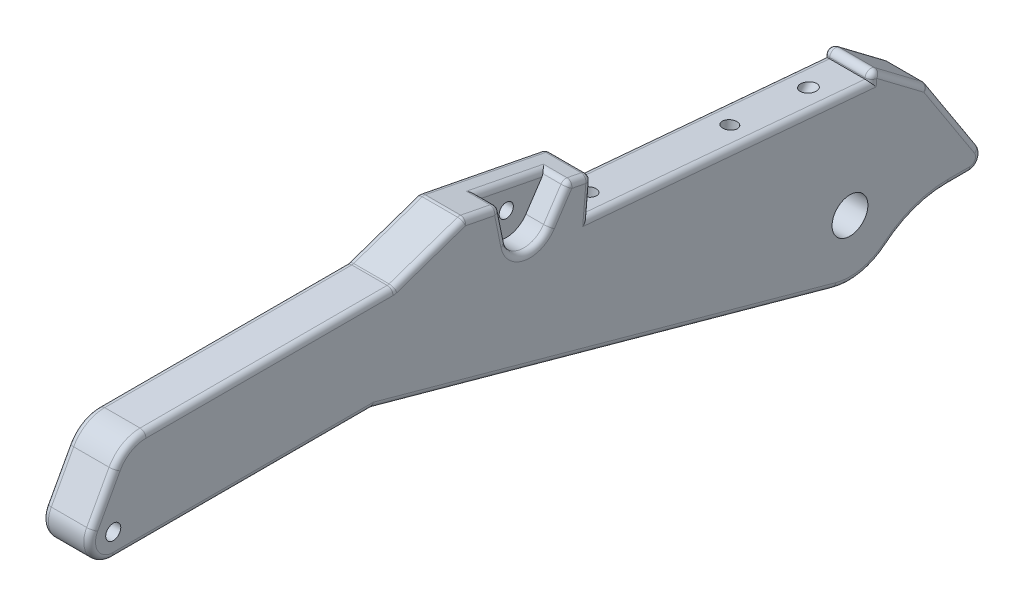
from build123d import *

# Parameters (mm, degrees)
SKETCH1_R           = 2.032
BOSS_EXTRUDE1_DEPTH = 12.7
FILLET1_R           = 9.525
SKETCH2_R           = 4.826
CUT_EXTRUDE1_DEPTH  = 238.90790865
CUT_EXTRUDE6_DEPTH  = 6.35
SKETCH10_R          = 1.905
CUT_EXTRUDE7_DEPTH  = 238.653540891
SKETCH4_R           = 5.715
CUT_EXTRUDE2_DEPTH  = 1.5875
FILLET2_R           = 1.5875
SKETCH6_R           = 1.905
CUT_EXTRUDE3_DEPTH  = 25.4
SKETCH7_R           = 1.905
CUT_EXTRUDE4_DEPTH  = 15.875
SKETCH8_R           = 1.905
CUT_EXTRUDE5_DEPTH  = 12.7


with BuildPart() as part:
    # Sketch1 → Boss-Extrude1 (new body)
    with BuildSketch(Plane(origin=(0, 0, 0), x_dir=(0, 0, -1), z_dir=(1, 0, 0))):
        with BuildLine():
            Line((-5.574599012, 3.040780467), (3.157961292, 19.05))
            Line((3.157961292, 19.05), (75.662744852, 19.05))
            Line((75.662744852, 19.05), (94.776183001, 25.614386431))
            Line((94.776183001, 25.614386431), (129.054233098, 18.923279907))
            Line((129.054233098, 18.923279907), (128.224074649, 9.434525408))
            Line((128.224074649, 9.434525408), (204.134110643, 2.79325781))
            Line((204.134110643, 2.79325781), (204.161005679, 3.100669472))
            ThreePointArc((204.161005679, 3.100669472), (205.09730431, 4.412800765), (206.698779384, 4.229439793))
            Line((206.698779384, 4.229439793), (219.392961654, -5.350975413))
            ThreePointArc((219.392961654, -5.350975413), (219.598467913, -5.536288257), (219.768672831, -5.75447157))
            Line((219.768672831, -5.75447157), (233.444725546, -26.84773219))
            ThreePointArc((233.444725546, -26.84773219), (233.570360338, -30.091006218), (230.780673949, -31.75))
            Line((230.780673949, -31.75), (224.896696771, -31.75))
            ThreePointArc((224.896696771, -31.75), (216.268745771, -33.260285445), (208.666831685, -37.611538462))
            ThreePointArc((208.666831685, -37.611538462), (201.862183679, -40.919877125), (194.299038193, -40.702691568))
            Line((194.299038193, -40.702691568), (69.85, -6.35))
            Line((69.85, -6.35), (0, -6.35))
            ThreePointArc((0, -6.35), (-5.460378007, -3.241415126), (-5.574599012, 3.040780467))
        make_face()
        Circle(SKETCH1_R, mode=Mode.SUBTRACT)
    extrude(amount=BOSS_EXTRUDE1_DEPTH)

    # Fillet1
    fillet1_edges = [part.edges().sort_by_distance(p)[0] for p in [
        (6.35, 19.05, -3.157961292),
    ]]
    fillet(fillet1_edges, radius=FILLET1_R)

    # Sketch2 → Cut-Extrude1 (cut, through all)
    with BuildSketch(Plane.ZY):
        with Locations((-198.523166007, -25.4)):
            Circle(SKETCH2_R)
    extrude(amount=-CUT_EXTRUDE1_DEPTH, mode=Mode.SUBTRACT)

    # Sketch9 → Cut-Extrude6 (cut)
    with BuildSketch(Plane(origin=(12.7, 0, 0), x_dir=(0, 0, -1), z_dir=(1, 0, 0))):
        with BuildLine():
            Line((106.035867409, 14.458235691), (104.124742118, 23.789539197))
            Line((104.124742118, 23.789539197), (122.821860353, 20.13984473))
            Line((122.821860353, 20.13984473), (117.541786323, 12.212269865))
            ThreePointArc((117.541786323, 12.212269865), (111.040171591, 9.499946473), (106.035867409, 14.458235691))
        make_face()
    extrude(amount=-CUT_EXTRUDE6_DEPTH, mode=Mode.SUBTRACT)

    # Sketch10 → Cut-Extrude7 (cut, through all)
    with BuildSketch(Plane(origin=(6.35, 0, 0), x_dir=(0, 0, -1), z_dir=(1, 0, 0))):
        with Locations((112.256736413, 15.732319218)):
            Circle(SKETCH10_R)
    extrude(amount=-CUT_EXTRUDE7_DEPTH, mode=Mode.SUBTRACT)

    # Sketch4 → Cut-Extrude2 (cut)
    with BuildSketch(Plane(origin=(0, 0, 0), x_dir=(0, 0, -1), z_dir=(1, 0, 0))):
        with Locations((198.523166007, -25.4)):
            Circle(SKETCH4_R)
    extrude(amount=CUT_EXTRUDE2_DEPTH, mode=Mode.SUBTRACT)

    # Fillet2
    fillet2_edges = [part.edges().sort_by_distance(p)[0] for p in [
        (0, 2.946963641, -204.147558161),
        (0, 4.412800765, -205.09730431),
        (0, -0.56076781, -213.045870519),
        (0, -5.536288257, -219.598467913),
        (0, -16.30110188, -226.606699189),
        (0, -30.091006218, -233.570360338),
        (0, -31.75, -227.83868536),
        (0, -33.260285445, -216.268745771),
        (0, -40.919877125, -201.862183679),
        (0, -6.35, -34.925),
        (0, -3.241415126, 5.460378007),
        (0, 8.563475584, 2.5621306),
        (0, 17.715567011, -3.950113643),
        (12.7, 2.946963641, -204.147558161),
        (12.7, 4.412800765, -205.09730431),
        (12.7, -0.56076781, -213.045870519),
        (12.7, -5.536288257, -219.598467913),
        (12.7, -16.30110188, -226.606699189),
        (12.7, -30.091006218, -233.570360338),
        (12.7, -31.75, -227.83868536),
        (12.7, -33.260285445, -216.268745771),
        (12.7, -40.919877125, -201.862183679),
        (12.7, -6.35, -34.925),
        (12.7, -3.241415126, 5.460378007),
        (12.7, 8.563475584, 2.5621306),
        (12.7, 17.715567011, -3.950113643),
        (0, -23.526345784, -132.074519097),
        (0, 6.113891609, -166.179092646),
        (0, 14.178902657, -128.639153874),
        (0, 19.05, -42.237490592),
        (12.7, -23.526345784, -132.074519097),
        (12.7, 6.113891609, -166.179092646),
        (12.7, 14.178902657, -128.639153874),
        (12.7, 19.05, -42.237490592),
        (12.7, 19.123887444, -105.080304764),
        (12.7, 16.176057297, -120.181823338),
        (12.7, 9.499946473, -111.040171591),
        (12.7, 19.531562318, -125.938046726),
        (0, 22.268833169, -111.91520805),
        (9.525, 20.13984473, -122.821860353),
        (9.525, 23.789539197, -104.124742118),
        (6.35, 21.964691963, -113.473301236),
        (12.7, 24.701962814, -99.45046256),
        (12.7, 22.332193215, -85.219463927),
        (0, 22.332193215, -85.219463927),
        (6.35, 25.614386431, -94.776183001),
        (6.35, 19.05, -75.662744852),
        (6.35, 18.923279907, -129.054233098),
    ]]
    fillet(fillet2_edges, radius=FILLET2_R)

    # Sketch6 → Cut-Extrude3 (cut)
    with BuildSketch(Plane(origin=(0, 102.082274381, -77.04242407), x_dir=(1, 0, 0), z_dir=(0, 0.798192165141452, -0.6024029112701905))):
        with Locations((6.35, 152.364748226)):
            Circle(SKETCH6_R)
    extrude(amount=-CUT_EXTRUDE3_DEPTH, mode=Mode.SUBTRACT)

    # Sketch7 → Cut-Extrude4 (cut)
    with BuildSketch(Plane(origin=(0, 20.495798036, -1.793149978), x_dir=(1, 0, 0), z_dir=(0, 0.996194698091746, -0.0871557427476538))):
        with Locations((6.35, 171.363870263)):
            Circle(SKETCH7_R)
        with Locations((6.35, 133.263870263)):
            Circle(SKETCH7_R)
    extrude(amount=-CUT_EXTRUDE4_DEPTH, mode=Mode.SUBTRACT)

    # Sketch8 → Cut-Extrude5 (cut)
    with BuildSketch(Plane(origin=(0, 98.615320401, -152.099344577), x_dir=(-1, 0, 0), z_dir=(0, 0.5440213575001199, -0.839071369183651))):
        with Locations((-6.35, -139.982344987)):
            Circle(SKETCH8_R)
    extrude(amount=-CUT_EXTRUDE5_DEPTH, mode=Mode.SUBTRACT)


solid = part.part
